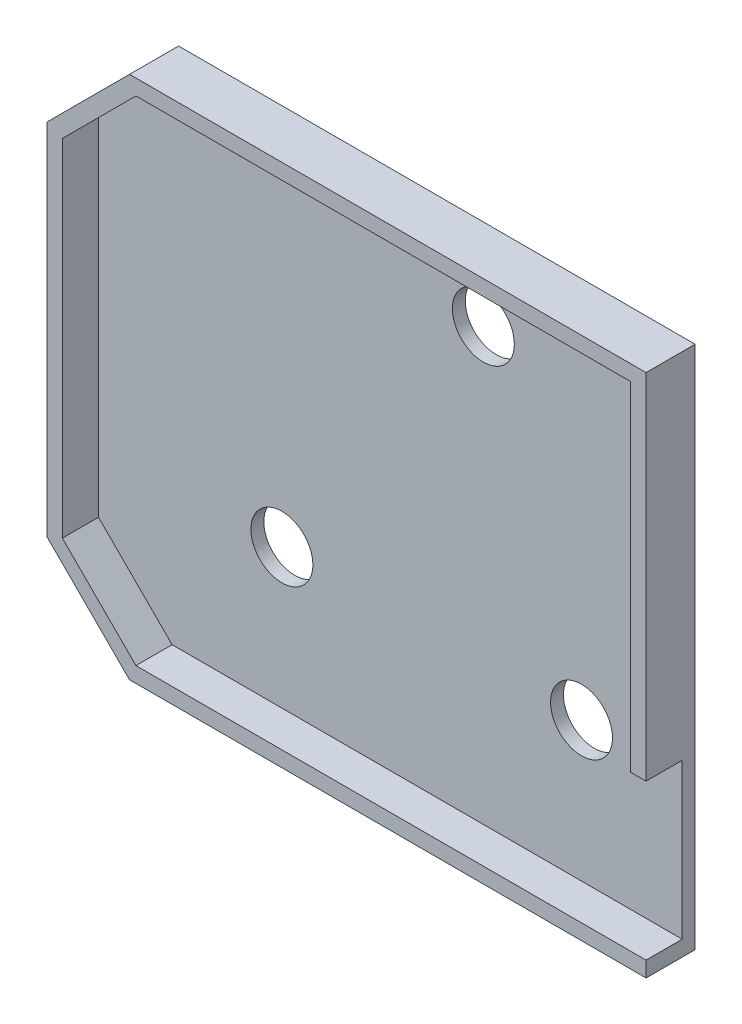
from build123d import *

# Parameters (mm, degrees)
BOSS_EXTRU_1_DEPTH      = 2.5
BOSS_EXTRU_2_DEPTH      = 7
ESQUISSE3_R             = 6
ENL_V_MAT_EXTRU_1_DEPTH = 10


with BuildPart() as part:
    # Esquisse1 → Boss.-Extru.1 (new body)
    with BuildSketch(Plane.XY):
        Polygon((0, -85), (16, -101), (116, -101), (116, 0.5), (16, 0.5), (0, -15.5), align=None)
    extrude(amount=BOSS_EXTRU_1_DEPTH)

    # Esquisse2 → Boss.-Extru.2 (add)
    with BuildSketch(Plane.XY.offset(2.5)):
        Polygon((3, -83.757359313), (17.242640687, -98), (113, -98), (116, -98), (116, -101), (16, -101), (0, -85), (0, -15.5), (16, 0.5), (116, 0.5), (116, -2.5), (116, -68), (113, -68), (113, -2.5), (17.242640687, -2.5), (3, -16.742640687), align=None)
    extrude(amount=BOSS_EXTRU_2_DEPTH)

    # Esquisse3 → Enlèv. mat.-Extru.1 (cut)
    with BuildSketch(Plane.XY.offset(2.5)):
        with Locations((96.5, -71)):
            Circle(ESQUISSE3_R)
        with Locations((77.5, -14.5)):
            Circle(ESQUISSE3_R)
        with Locations((38.5, -71)):
            Circle(ESQUISSE3_R)
    extrude(amount=-ENL_V_MAT_EXTRU_1_DEPTH, mode=Mode.SUBTRACT)


solid = part.part
